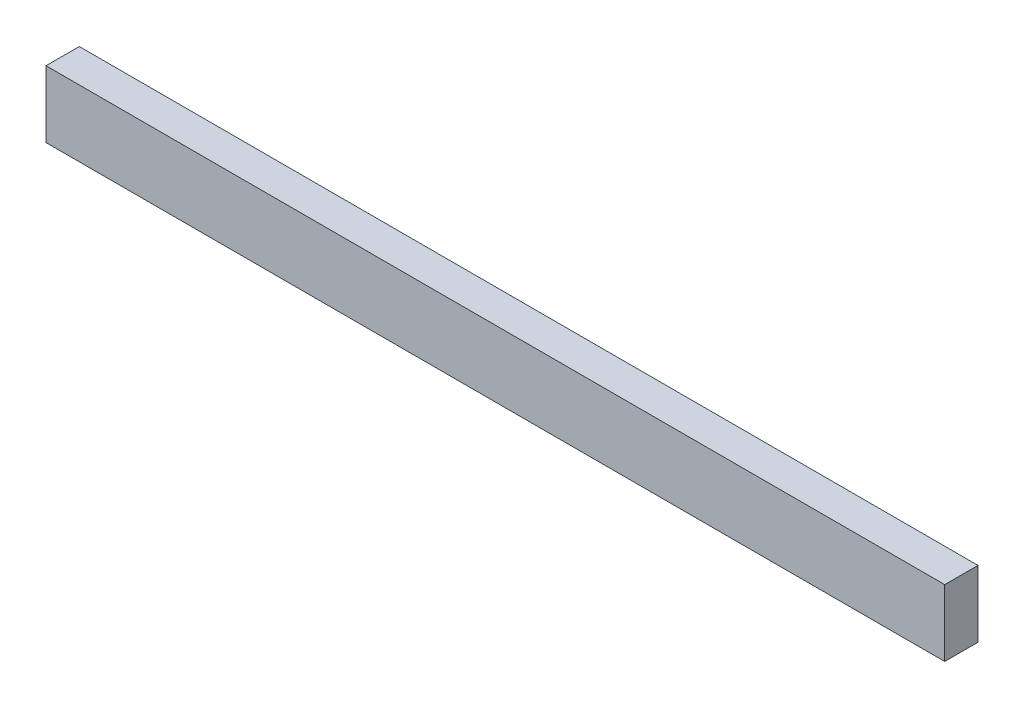
from build123d import *

# Parameters (mm, degrees)
SKETCH1_W           = 270
SKETCH1_H           = 10
BOSS_EXTRUDE1_DEPTH = 20


with BuildPart() as part:
    # Sketch1 → Boss-Extrude1 (new body)
    with BuildSketch(Plane(origin=(0, 0, 0), x_dir=(1, 0, 0), z_dir=(0, 1, 0))):
        with Locations((24.245614035, -37.99122807)):
            Rectangle(SKETCH1_W, SKETCH1_H)
    extrude(amount=BOSS_EXTRUDE1_DEPTH)


solid = part.part
